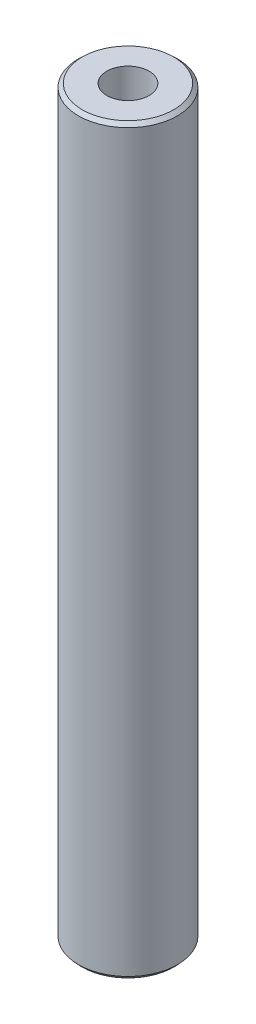
from build123d import *
from OCP.BRepFilletAPI import BRepFilletAPI_MakeChamfer

# Parameters (mm, degrees)
SKETCH1_R           = 40
BOSS_EXTRUDE1_DEPTH = 600
SKETCH2_R           = 17.095587012
CUT_EXTRUDE1_DEPTH  = 603.660766933
CHAMFER1_SIZE       = 2.770158321
CHAMFER1_SIZE2      = 3.024820862


with BuildPart() as part:
    # Sketch1 → Boss-Extrude1 (new body)
    with BuildSketch(Plane(origin=(0, 0, 0), x_dir=(1, 0, 0), z_dir=(0, 1, 0))):
        Circle(SKETCH1_R)
    extrude(amount=BOSS_EXTRUDE1_DEPTH)

    # Sketch2 → Cut-Extrude1 (cut, through all)
    with BuildSketch(Plane(origin=(0, 0, 0), x_dir=(1, 0, 0), z_dir=(0, 1, 0))):
        Circle(SKETCH2_R)
    extrude(amount=CUT_EXTRUDE1_DEPTH, mode=Mode.SUBTRACT)

    # Chamfer1: one chamfer whose edges measure the first distance from different faces: ONE call of the kernel's chamfer builder (chamfer() names one face for all edges)
    chamfer1_edges_1 = [part.edges().sort_by_distance(p)[0] for p in [
        (-40, 600, 0),
    ]]
    chamfer1_side_1 = [part.faces().sort_by_distance(p)[0] for p in [
        (-40, 300, 0),
    ]]
    chamfer1_edges_2 = [part.edges().sort_by_distance(p)[0] for p in [
        (-40, 0, 0),
    ]]
    chamfer1_side_2 = [part.faces().sort_by_distance(p)[0] for p in [
        (-38.86862915, 0, 0),
    ]]
    chamfer1 = BRepFilletAPI_MakeChamfer(part.part.solid().wrapped)
    for e in chamfer1_edges_1:
        chamfer1.Add(CHAMFER1_SIZE, CHAMFER1_SIZE2, e.wrapped, chamfer1_side_1[0].wrapped)  # the first distance lies on this face
    for e in chamfer1_edges_2:
        chamfer1.Add(CHAMFER1_SIZE, CHAMFER1_SIZE2, e.wrapped, chamfer1_side_2[0].wrapped)  # the first distance lies on this face
    add(Compound.cast(chamfer1.Shape()), mode=Mode.REPLACE)


solid = part.part
